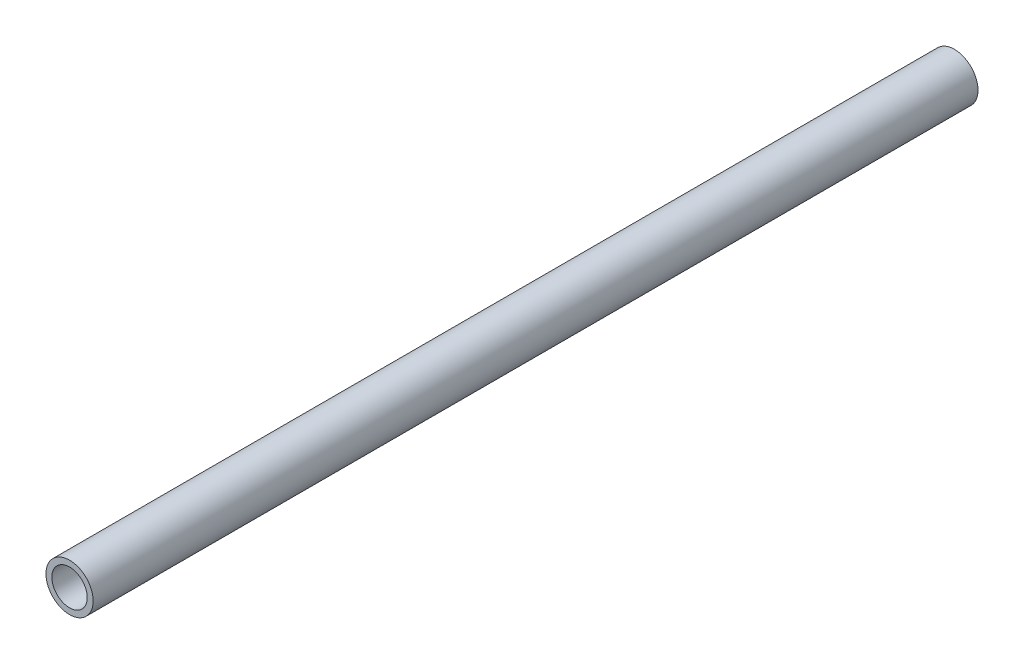
from build123d import *

# Parameters (mm, degrees)
SKETCH1_R           = 20
SKETCH1_R_2         = 15
BOSS_EXTRUDE1_DEPTH = 750


with BuildPart() as part:
    # Sketch1 → Boss-Extrude1 (new body)
    with BuildSketch(Plane.XY):
        Circle(SKETCH1_R)
        Circle(SKETCH1_R_2, mode=Mode.SUBTRACT)
    extrude(amount=BOSS_EXTRUDE1_DEPTH)


solid = part.part
